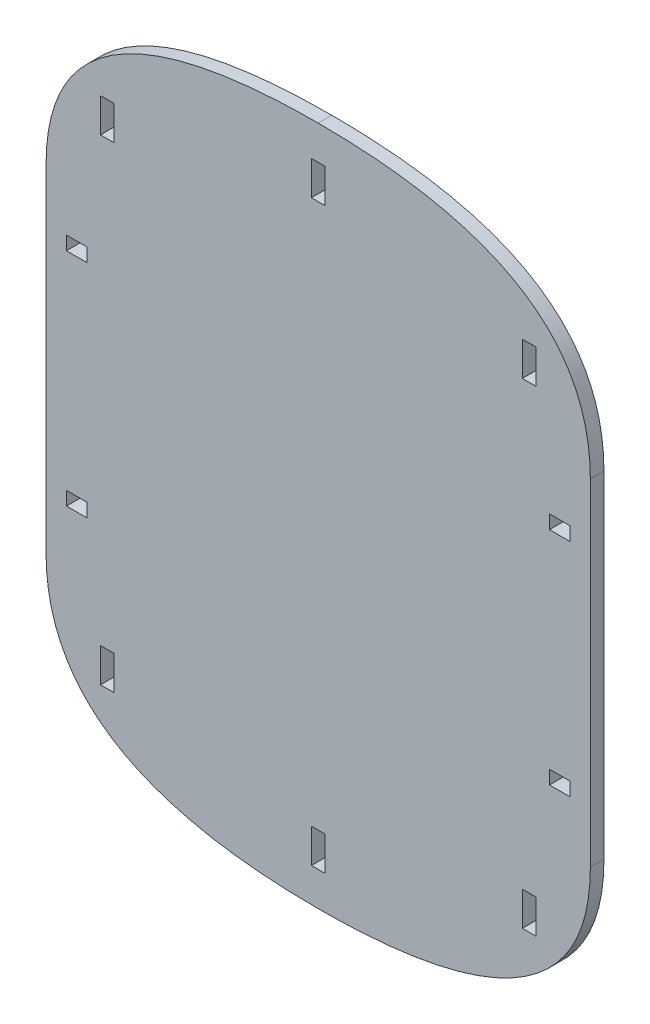
from build123d import *

# Parameters (mm, degrees)
SKETCH1_W           = 203.2
SKETCH1_H           = 254
BOSS_EXTRUDE1_DEPTH = 5.08
FILLET1_SIZE        = 64.219666667
FILLET1_SIZE_2      = 101.6
SKETCH14_W          = 5.08
SKETCH14_H          = 12.7
CUT_EXTRUDE2_DEPTH  = 326.318377121
CUT_EXTRUDE3_DEPTH  = 326.318377121


with BuildPart() as part:
    # Sketch1 → Boss-Extrude1 (new body)
    with BuildSketch(Plane.XY):
        with Locations((101.6, 127)):
            Rectangle(SKETCH1_W, SKETCH1_H)
    extrude(amount=BOSS_EXTRUDE1_DEPTH)

    # Fillet1
    # a fillet whose section is not a circle: 101.6, 64.219666667 mm, written as the material it takes off along each edge
    with BuildSketch(Plane(origin=(203.2, 254, -254), x_dir=(0, -1, 0), z_dir=(0, 0, 1))) as fillet1_piece_1:
        with BuildLine():
            Bezier((FILLET1_SIZE, 0), (0, 0), (0, -FILLET1_SIZE_2), weights=[1, 1, 1])
            Line((0, -FILLET1_SIZE_2), (0, 0))
            Line((0, 0), (FILLET1_SIZE, 0))
        make_face()
    extrude(amount=513.08, mode=Mode.SUBTRACT)
    with BuildSketch(Plane(origin=(0, 254, -254), x_dir=(1, 0, 0), z_dir=(0, 0, 1)), Plane(origin=(203.2, 0, -254), x_dir=(-1, 0, 0), z_dir=(0, 0, 1))) as fillet1_piece_2:
        with BuildLine():
            Bezier((FILLET1_SIZE_2, 0), (0, 0), (0, -FILLET1_SIZE), weights=[1, 1, 1])
            Line((0, -FILLET1_SIZE), (0, 0))
            Line((0, 0), (FILLET1_SIZE_2, 0))
        make_face()
    extrude(amount=513.08, mode=Mode.SUBTRACT)
    with BuildSketch(Plane(origin=(0, 0, -254), x_dir=(1, 0, 0), z_dir=(0, 0, 1))) as fillet1_piece_3:
        with BuildLine():
            Bezier((FILLET1_SIZE_2, 0), (0, 0), (0, FILLET1_SIZE), weights=[1, 1, 1])
            Line((0, FILLET1_SIZE), (0, 0))
            Line((0, 0), (FILLET1_SIZE_2, 0))
        make_face()
    extrude(amount=513.08, mode=Mode.SUBTRACT)

    # Sketch14 → Cut-Extrude2 (cut, through all)
    with BuildSketch(Plane.XY.offset(5.08)):
        with Locations((101.6, 234.95)):
            Rectangle(SKETCH14_W, SKETCH14_H)
        with Locations((101.6, 19.05)):
            Rectangle(SKETCH14_W, SKETCH14_H)
    extrude(amount=-CUT_EXTRUDE2_DEPTH, mode=Mode.SUBTRACT)

    # Sketch13 → Cut-Extrude3 (cut, through all)
    with BuildSketch(Plane.XY.offset(5.08)):
        Polygon((25.4, 222.25), (20.32, 222.25), (20.32, 209.55), (25.4, 209.55), (25.4, 215.9), align=None)
        Polygon((177.8, 215.9), (177.8, 222.25), (182.88, 222.25), (182.88, 209.55), (177.8, 209.55), align=None)
        Polygon((177.8, 38.1), (177.8, 44.45), (182.88, 44.45), (182.88, 31.75), (177.8, 31.75), align=None)
        Polygon((25.4, 38.1), (25.4, 44.45), (20.32, 44.45), (20.32, 31.75), (25.4, 31.75), align=None)
        Polygon((187.96, 168.275), (187.96, 165.735), (195.58, 165.735), (195.58, 170.815), (187.96, 170.815), align=None)
        Polygon((187.96, 85.725), (187.96, 88.265), (195.58, 88.265), (195.58, 83.185), (187.96, 83.185), align=None)
        Polygon((15.24, 168.275), (15.24, 170.815), (7.62, 170.815), (7.62, 165.735), (15.24, 165.735), align=None)
        Polygon((15.24, 85.725), (15.24, 88.265), (7.62, 88.265), (7.62, 83.185), (15.24, 83.185), align=None)
    extrude(amount=-CUT_EXTRUDE3_DEPTH, mode=Mode.SUBTRACT)


solid = part.part
